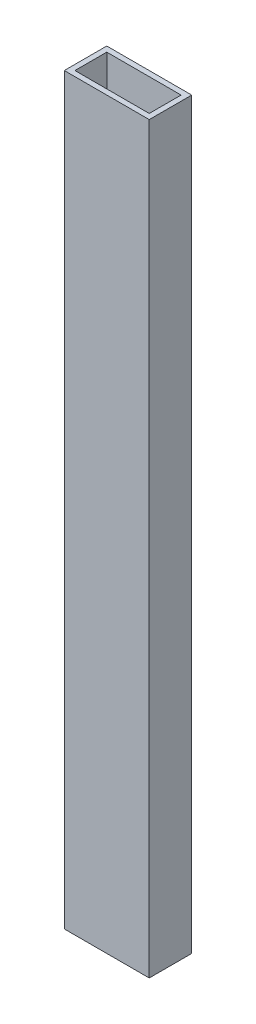
from build123d import *

# Parameters (mm, degrees)
SKETCH1_W           = 50.8
SKETCH1_H           = 25.4
SKETCH1_W_2         = 44.45
SKETCH1_H_2         = 19.05
BOSS_EXTRUDE1_DEPTH = 444.5


with BuildPart() as part:
    # Sketch1 → Boss-Extrude1 (new body)
    with BuildSketch(Plane(origin=(0, 0, 0), x_dir=(1, 0, 0), z_dir=(0, 1, 0))):
        with Locations((25.4, 12.7)):
            Rectangle(SKETCH1_W, SKETCH1_H)
        with Locations((25.4, 12.7)):
            Rectangle(SKETCH1_W_2, SKETCH1_H_2, mode=Mode.SUBTRACT)
    extrude(amount=BOSS_EXTRUDE1_DEPTH)


solid = part.part
